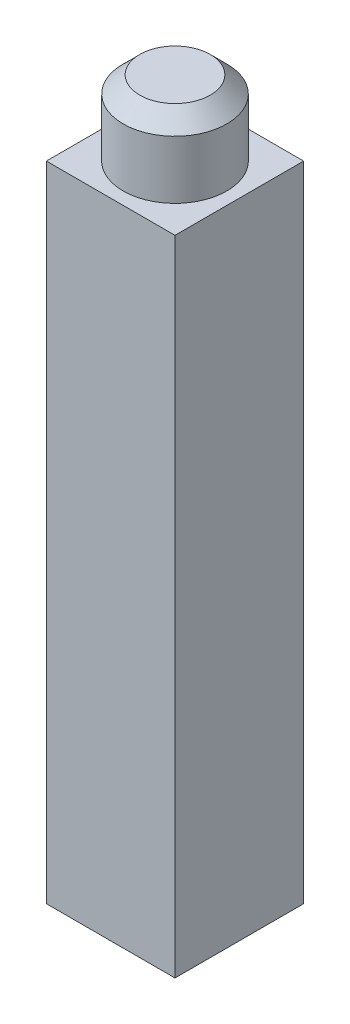
from build123d import *

# Parameters (mm, degrees)
AUFSATZ_LINEAR_AUSTRAGEN1_OUTLINE_W = 3.1
AUFSATZ_LINEAR_AUSTRAGEN1_OUTLINE_H = 3.1
AUFSATZ_LINEAR_AUSTRAGEN1_DEPTH     = 15.5
SKIZZE2_R                           = 1.25
AUFSATZ_LINEAR_AUSTRAGEN2_DEPTH     = 1.8
FASE1_SIZE                          = 0.4


# Read off the part's stored shape, not the designer's step: Aufsatz-Linear austragen1
with BuildPart() as part:
    # Aufsatz-Linear austragen1 outline → Aufsatz-Linear austragen1 (new body)
    with BuildSketch(Plane(origin=(0, -17.3, 0), x_dir=(1, 0, 0), z_dir=(0, 1, 0))):
        with Locations((3.5, -3.5)):
            Rectangle(AUFSATZ_LINEAR_AUSTRAGEN1_OUTLINE_W, AUFSATZ_LINEAR_AUSTRAGEN1_OUTLINE_H)
    extrude(amount=AUFSATZ_LINEAR_AUSTRAGEN1_DEPTH)

    # Skizze2 → Aufsatz-Linear austragen2 (add)
    with BuildSketch(Plane(origin=(0, -1.8, 0), x_dir=(1, 0, 0), z_dir=(0, 1, 0))):
        with Locations(Location((3.5, -3.5, 0), (0, 0, 270))):
            Circle(SKIZZE2_R)
    extrude(amount=AUFSATZ_LINEAR_AUSTRAGEN2_DEPTH)

    # Fase1
    fase1_edges = [part.edges().sort_by_distance(p)[0] for p in [
        (3.5, 0, 2.25),
    ]]
    chamfer(fase1_edges, length=FASE1_SIZE)


solid = part.part
